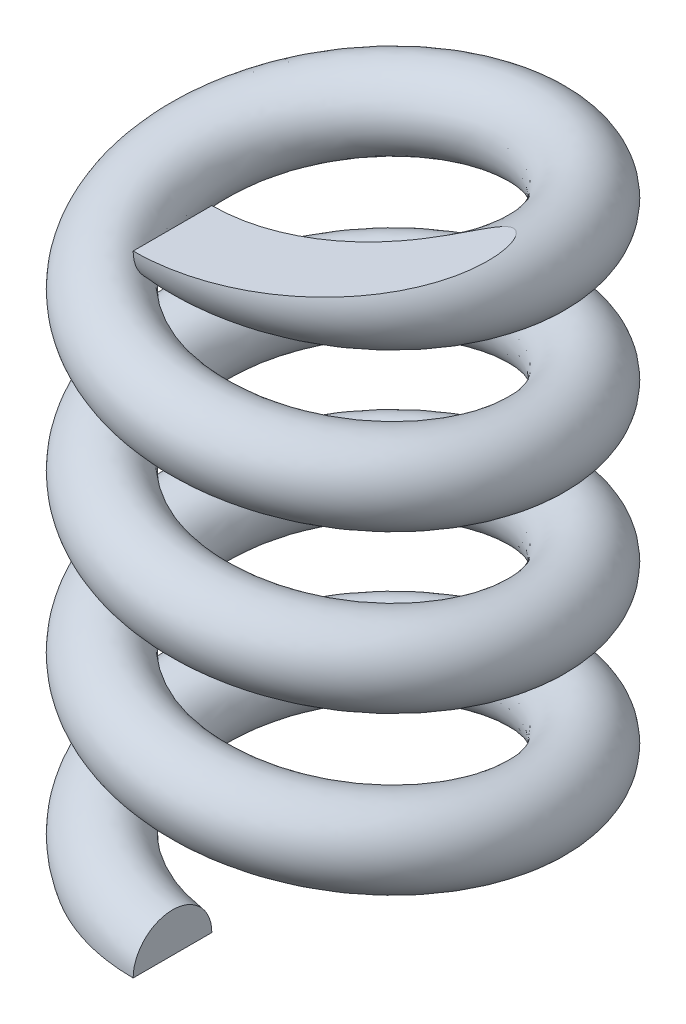
from build123d import *

# Parameters (mm, degrees)
SWEEP1_PITCH     = 30
SWEEP1_HEIGHT    = 120
SWEEP1_RADIUS    = 32.5
SKETCH2_R        = 7.5
SPLIT1_START     = -7.5
SPLIT1_OUTLINE_W = 37
SPLIT1_OUTLINE_H = 43
SPLIT1_DEPTH     = 7.5


# Read off the part's stored shape, not the designer's step: Split1
with BuildPart() as part:
    # Sweep1: sweep along a helix
    with BuildLine() as sweep1_path:
        Helix(SWEEP1_PITCH, SWEEP1_HEIGHT, SWEEP1_RADIUS, center=(0, 0, 0), direction=(0, 1, 0), lefthand=True)
    # Sketch2 → Sweep1 (sweep)
    with BuildSketch(Plane(origin=(0, 0, 0), x_dir=(0, 0, -1), z_dir=(1, 0, 0))):
        with Locations((-32.5, 0)):
            Circle(SKETCH2_R)
    sweep(path=sweep1_path.line, is_frenet=True)

    # Split1 outline → Split1 (cut)
    with BuildSketch(Plane(origin=(0, 0, 0), x_dir=(1, 0, 0), z_dir=(0, 1, 0)).offset(SPLIT1_START)):
        with Locations((-18.5, -20.5)):
            Rectangle(SPLIT1_OUTLINE_W, SPLIT1_OUTLINE_H)
    extrude(amount=SPLIT1_DEPTH, mode=Mode.SUBTRACT)

    # Split2
    split(bisect_by=Plane.ZX.offset(120), keep=Keep.BOTTOM)


solid = part.part
